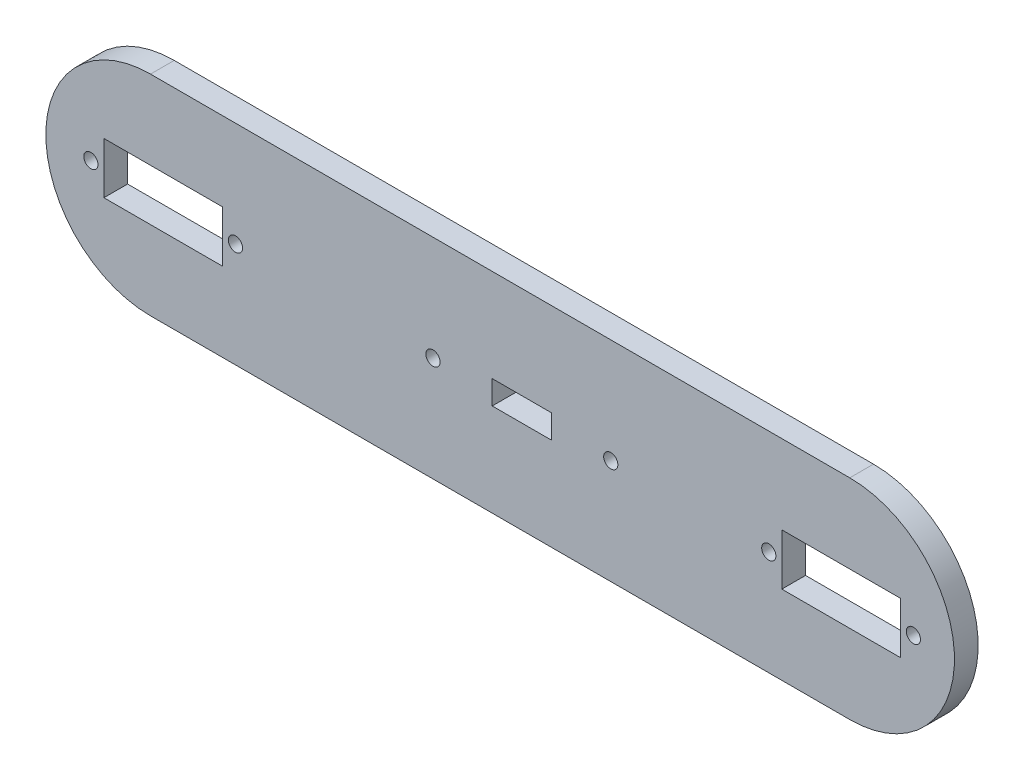
from build123d import *

# Parameters (mm, degrees)
ESBO_O1_R                = 1.8
ESBO_O1_W                = 15
ESBO_O1_H                = 6
ESBO_O1_W_2              = 30
ESBO_O1_H_2              = 13
RESSALTO_EXTRUS_O1_DEPTH = 6


with BuildPart() as part:
    # Esboço1 → Ressalto-extrusão1 (new body)
    with BuildSketch(Plane.XY):
        with BuildLine():
            Line((-94, 26.5), (83, 26.5))
            ThreePointArc((83, 26.5), (109.5, 0), (83, -26.5))
            Line((83, -26.5), (-94, -26.5))
            ThreePointArc((-94, -26.5), (-120.5, 0), (-94, 26.5))
        make_face()
        with Locations((-22.5, 0)):
            Circle(ESBO_O1_R, mode=Mode.SUBTRACT)
        with Locations((22.5, 0)):
            Circle(ESBO_O1_R, mode=Mode.SUBTRACT)
        with Locations((-109.1, 0)):
            Circle(ESBO_O1_R, mode=Mode.SUBTRACT)
        with Locations((-72.5, 0)):
            Circle(ESBO_O1_R, mode=Mode.SUBTRACT)
        with Locations((62.5, 0)):
            Circle(ESBO_O1_R, mode=Mode.SUBTRACT)
        with Locations((99.1, 0)):
            Circle(ESBO_O1_R, mode=Mode.SUBTRACT)
        Rectangle(ESBO_O1_W, ESBO_O1_H, mode=Mode.SUBTRACT)
        with Locations((-90.8, 0)):
            Rectangle(ESBO_O1_W_2, ESBO_O1_H_2, mode=Mode.SUBTRACT)
        with Locations((80.8, 0)):
            Rectangle(ESBO_O1_W_2, ESBO_O1_H_2, mode=Mode.SUBTRACT)
    extrude(amount=RESSALTO_EXTRUS_O1_DEPTH)


solid = part.part
